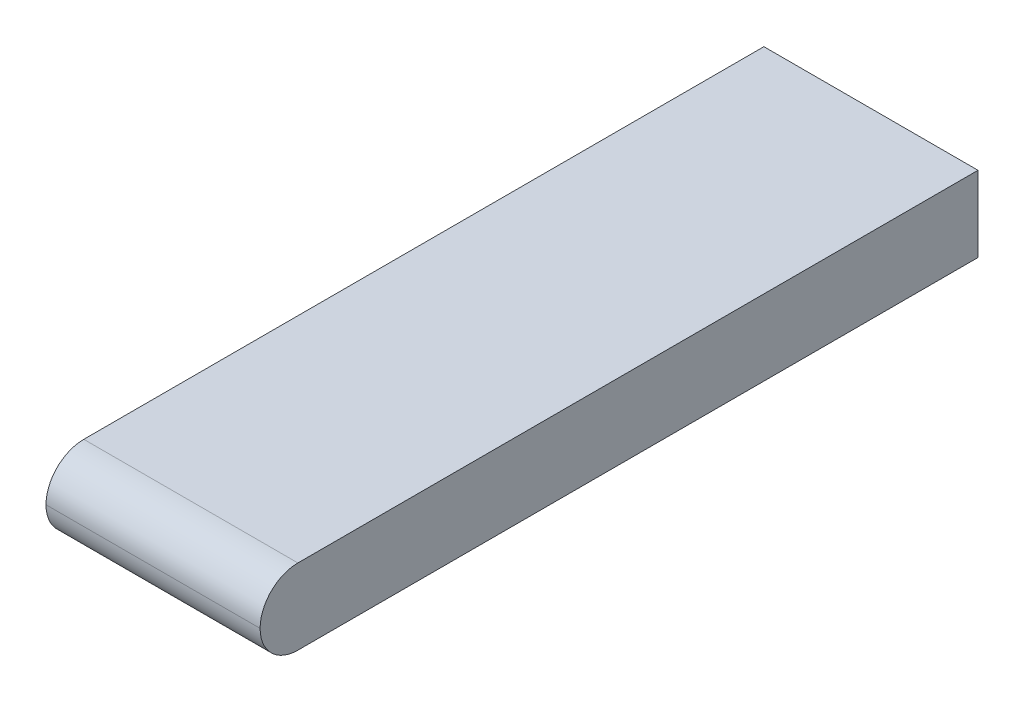
from build123d import *

# Parameters (mm, degrees)
SKETCH1_W           = 43.18
SKETCH1_H           = 144.78
BOSS_EXTRUDE1_DEPTH = 15.24
FILLET1_R           = 7.62


with BuildPart() as part:
    # Sketch1 → Boss-Extrude1 (new body)
    with BuildSketch(Plane(origin=(0, 0, 0), x_dir=(1, 0, 0), z_dir=(0, 1, 0))):
        Rectangle(SKETCH1_W, SKETCH1_H)
    extrude(amount=BOSS_EXTRUDE1_DEPTH)

    # Fillet1
    fillet1_edges = [part.edges().sort_by_distance(p)[0] for p in [
        (0, 0, 72.39),
        (0, 15.24, 72.39),
    ]]
    fillet(fillet1_edges, radius=FILLET1_R - 0.0001)  # a hair under: the kernel refuses the full size


solid = part.part
